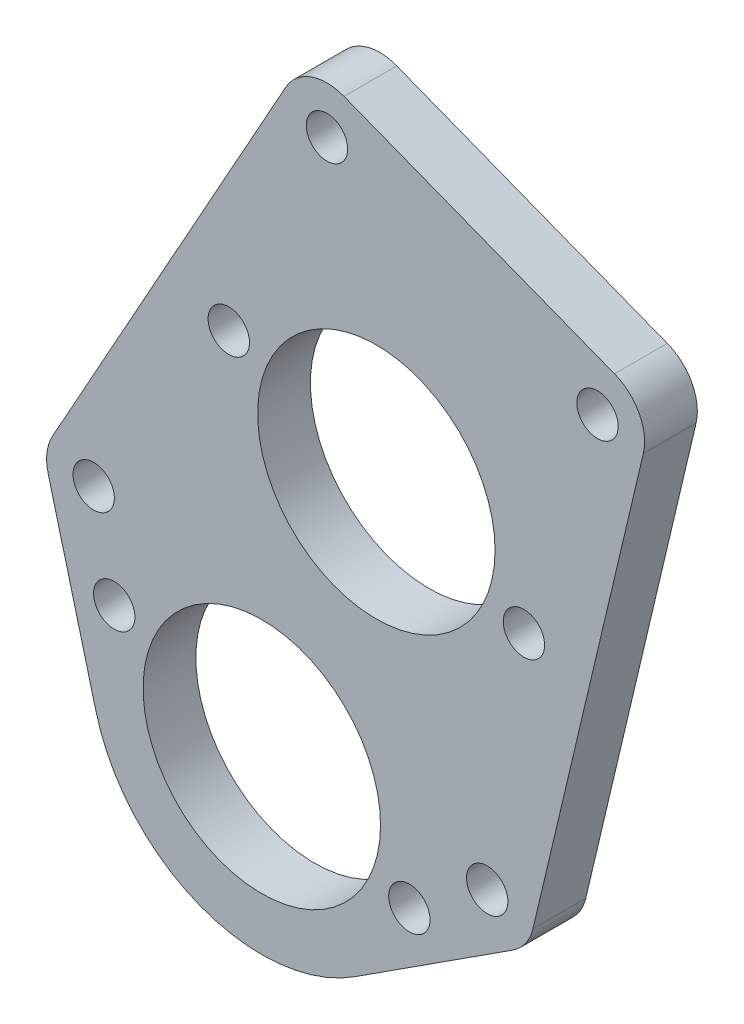
from build123d import *

# Parameters (mm, degrees)
SKETCH1_R           = 14.2875
SKETCH1_R_2         = 2.4892
BOSS_EXTRUDE1_DEPTH = 3.175


with BuildPart() as part:
    # Sketch1 → Boss-Extrude1 (new, symmetric)
    with BuildSketch(Plane.XY):
        with BuildLine():
            Line((-25.711392616, 16.628788534), (-19.959064153, -5.248062916))
            ThreePointArc((-19.959064153, -5.248062916), (-7.46638511, -19.239529611), (11.194044807, -17.337813216))
            Line((11.194044807, -17.337813216), (30.197779716, -5.06817705))
            ThreePointArc((30.197779716, -5.06817705), (31.7523553, -3.576854941), (32.637660193, -1.61293485))
            Line((32.637660193, -1.61293485), (45.913984494, 54.537449114))
            ThreePointArc((45.913984494, 54.537449114), (45.414811653, 58.477541991), (42.451004801, 61.121280699))
            Line((42.451004801, 61.121280699), (9.891800845, 73.756701654))
            ThreePointArc((9.891800845, 73.756701654), (5.920498899, 73.804306972), (2.894170056, 71.232374014))
            Line((2.894170056, 71.232374014), (-25.181792407, 20.825363212))
            ThreePointArc((-25.181792407, 20.825363212), (-25.853024864, 18.778366908), (-25.711392616, 16.628788534))
        make_face()
        Circle(SKETCH1_R, mode=Mode.SUBTRACT)
        with Locations((13.784095588, 35.519131589)):
            Circle(SKETCH1_R, mode=Mode.SUBTRACT)
        with Locations((-20.233397162, 18.069179956)):
            Circle(SKETCH1_R_2, mode=Mode.SUBTRACT)
        with Locations((27.125444956, -0.309614161)):
            Circle(SKETCH1_R_2, mode=Mode.SUBTRACT)
        with Locations((40.401769257, 55.840769803)):
            Circle(SKETCH1_R_2, mode=Mode.SUBTRACT)
        with Locations((7.842565301, 68.476190758)):
            Circle(SKETCH1_R_2, mode=Mode.SUBTRACT)
        with Locations((-17.759565794, 6.892047794)):
            Circle(SKETCH1_R_2, mode=Mode.SUBTRACT)
        with Locations((17.759565794, -6.892047794)):
            Circle(SKETCH1_R_2, mode=Mode.SUBTRACT)
        with Locations((-3.975470206, 42.411179383)):
            Circle(SKETCH1_R_2, mode=Mode.SUBTRACT)
        with Locations((31.543661382, 28.627083795)):
            Circle(SKETCH1_R_2, mode=Mode.SUBTRACT)
    extrude(amount=BOSS_EXTRUDE1_DEPTH, both=True)


solid = part.part
